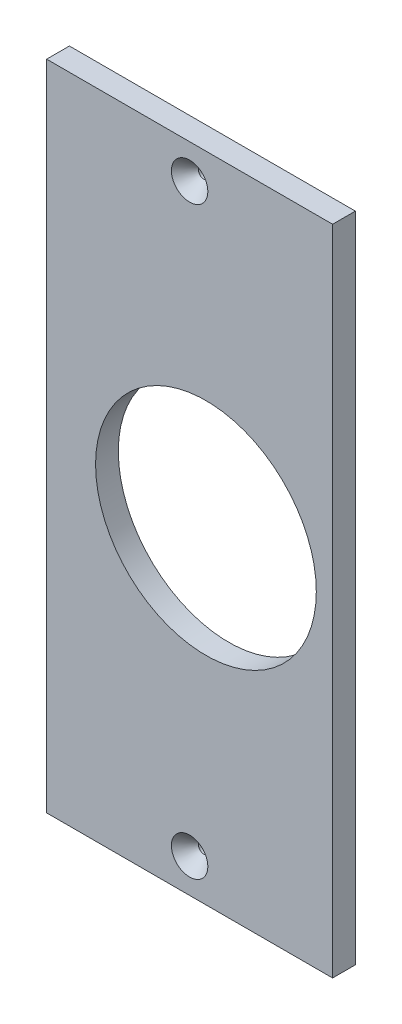
from build123d import *

# Parameters (mm, degrees)
SKETCH1_W                   = 79.793650928
SKETCH1_H                   = 182.149999994
BOSS_EXTRUDE1_DEPTH         = 6.35
F_1_4_0_25_DIAMETER_HOLE1_D = 6.35
HOLE1_D                     = 3.175
HOLE1_DEPTH                 = 31.75
HOLE1_CSINK_D               = 10.16
HOLE1_CSINK_ANGLE           = 82
HOLE1_TIP                   = 0.953866233
SKETCH8_R                   = 30.7975
CUT_EXTRUDE1_DEPTH          = 355.374812115


with BuildPart() as part:
    # Sketch1 → Boss-Extrude1 (new body)
    with BuildSketch(Plane.XY):
        with Locations((-274.649792645, -72.024999997)):
            Rectangle(SKETCH1_W, SKETCH1_H)
    extrude(amount=BOSS_EXTRUDE1_DEPTH)

    # 1/4 (0.25) Diameter Hole1 (through all)
    with Locations(Plane.XY.offset(6.35)):
        with Locations((-270.096618017, -72.024999997)):
            Hole(F_1_4_0_25_DIAMETER_HOLE1_D / 2)

    # Hole1
    with Locations(Plane(origin=(181.039434513, -72.024999997, 6.35), x_dir=(0, 1, 0), z_dir=(0, 0, 1))):
        with Locations((81.549999997, 455.689227112), (-81.549999997, 455.689227112)):
            CounterSinkHole(HOLE1_D / 2, HOLE1_CSINK_D / 2, depth=HOLE1_DEPTH, counter_sink_angle=HOLE1_CSINK_ANGLE)
            with Locations((0, 0, -(HOLE1_DEPTH + HOLE1_TIP / 2))):  # 118° drill point
                Cone(0, HOLE1_D / 2, HOLE1_TIP, mode=Mode.SUBTRACT)

    # Sketch8 → Cut-Extrude1 (cut, through all)
    with BuildSketch(Plane.XY.offset(6.35)):
        with Locations((-270.096618017, -72.024999997)):
            Circle(SKETCH8_R)
    extrude(amount=-CUT_EXTRUDE1_DEPTH, mode=Mode.SUBTRACT)


solid = part.part
